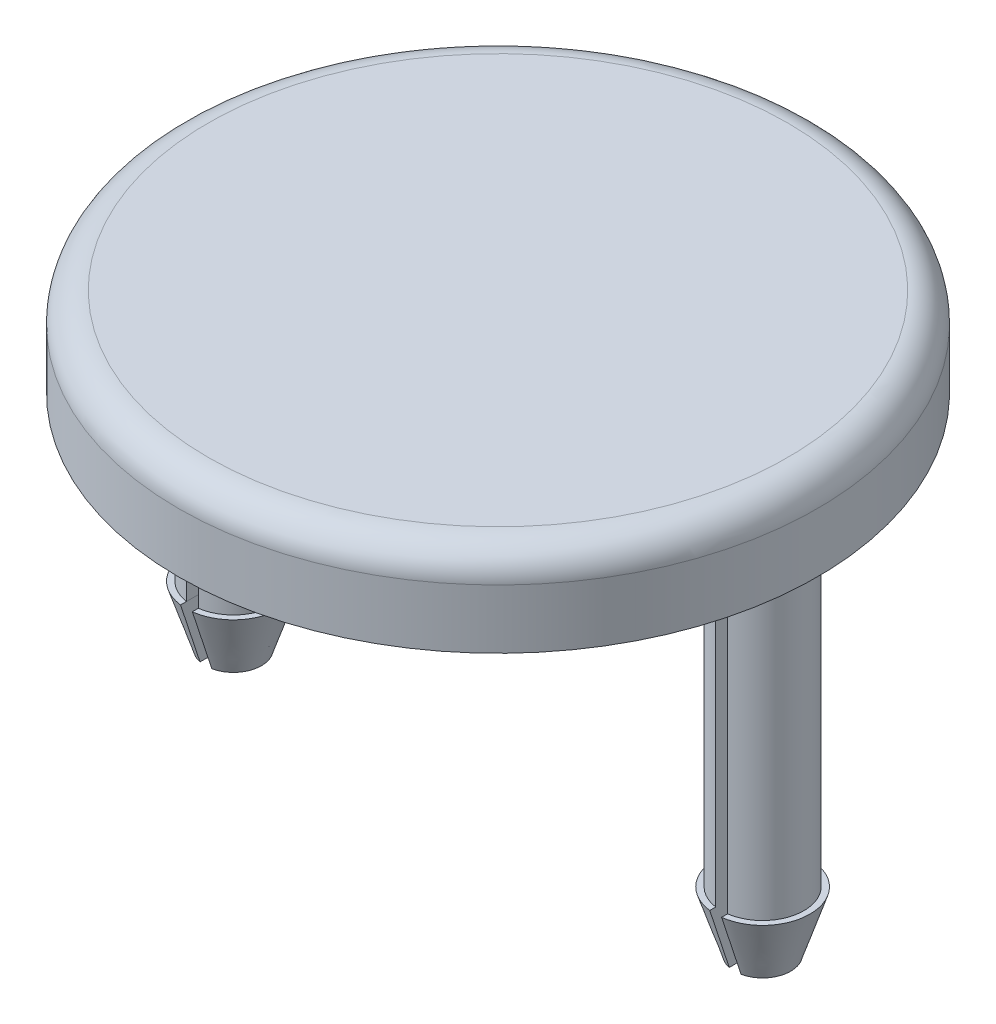
from build123d import *

# Parameters (mm, degrees)
SKETCH1_R           = 10.8
BOSS_EXTRUDE1_DEPTH = 3
BOSS_EXTRUDE3_DEPTH = 10
MIRROR3_START       = -10
MIRROR3_DEPTH       = 10
FILLET1_R           = 1
SKETCH6_R           = 2.4
BOSS_EXTRUDE4_DEPTH = 2
FILLET2_R           = 0.3


with BuildPart() as part:
    # Sketch1 → Boss-Extrude1 (new body)
    with BuildSketch(Plane(origin=(0, 0, 0), x_dir=(1, 0, 0), z_dir=(0, 1, 0))):
        with Locations(Location((0, 0, 0), (0, 0, 270))):
            Circle(SKETCH1_R)
    extrude(amount=BOSS_EXTRUDE1_DEPTH)

    # Sketch2 → Boss-Extrude3 (add)
    with BuildSketch(Plane.XZ):
        with BuildLine():
            Line((-9.15, 0), (-9.15, 1.385640646))
            ThreePointArc((-9.15, 1.385640646), (-10.35, 0), (-9.15, -1.385640646))
            Line((-9.15, -1.385640646), (-9.15, 0))
        make_face()
    boss_extrude3 = extrude(amount=BOSS_EXTRUDE3_DEPTH)


with BuildPart() as body_2:
    # Loft3: read off the stored shape, not the designer's step
    # Loft3: loft between two sections, ruled curve by curve
    loft3_from = [
        Edge.make_bspline([(-9.15, -10, 1.587450787), (-11.67, -10, 1.269960629), (-11.67, -10, -1.269960629), (-9.15, -10, -1.587450787)], [0, 0, 0, 0, 1, 1, 1, 1], 3, [1, 0.416666667, 0.416666667, 1]),
        Edge.make_line((-9.15, -10, 1.587450787), (-9.15, -10, -1.587450787)),
    ]
    loft3_to = [
        Edge.make_bspline([(-9.15, -12, 0.928708781), (-10.427777778, -12, 0.653535809), (-10.427777778, -12, -0.653535809), (-9.15, -12, -0.928708781)], [0, 0, 0, 0, 1, 1, 1, 1], 3, [1, 0.473684211, 0.473684211, 1]),
        Edge.make_line((-9.15, -12, 0.928708781), (-9.15, -12, -0.928708781)),
    ]
    loft3 = Solid(Shell([*[Face.make_surface_from_curves(loft3_from[k], loft3_to[k]) for k in range(2)], Face(Wire(loft3_from)), Face(Wire(loft3_to))]))
    add(loft3)


with BuildPart() as part_1:
    add(part.part)

    # Mirror2: Boss-Extrude3, Loft3 across plane
    add(boss_extrude3.mirror(Plane(origin=(-8.95, 0, 0), x_dir=(0, 0, 1), z_dir=(1, 0, 0))))
    add(loft3.mirror(Plane(origin=(-8.95, 0, 0), x_dir=(0, 0, 1), z_dir=(1, 0, 0))))

    # Mirror3: read off the stored shape, not the designer's step
    # Mirror3 outline → Mirror3 (add)
    with BuildSketch(Plane(origin=(0, 0, 0), x_dir=(1, 0, 0), z_dir=(0, 1, 0)).offset(MIRROR3_START)):
        with BuildLine():
            Line((9.15, 1.385640646), (9.15, -1.385640646))
            ThreePointArc((9.15, -1.385640646), (10.35, 0), (9.15, 1.385640646))
        make_face()
        with BuildLine():
            Line((8.75, -1.385640646), (8.75, 1.385640646))
            ThreePointArc((8.75, 1.385640646), (7.55, 0), (8.75, -1.385640646))
        make_face()
    extrude(amount=MIRROR3_DEPTH)

    # Mirror3 2: loft between two sections, ruled curve by curve
    mirror3_2_from = [
        Edge.make_bspline([(8.75, -10, 1.587450787), (6.23, -10, 1.269960629), (6.23, -10, -1.269960629), (8.75, -10, -1.587450787)], [0, 0, 0, 0, 1, 1, 1, 1], 3, [1, 0.416666667, 0.416666667, 1]),
        Edge.make_line((8.75, -10, -1.587450787), (8.75, -10, 1.587450787)),
    ]
    mirror3_2_to = [
        Edge.make_bspline([(8.75, -12, 0.928708781), (7.472222222, -12, 0.653535809), (7.472222222, -12, -0.653535809), (8.75, -12, -0.928708781)], [0, 0, 0, 0, 1, 1, 1, 1], 3, [1, 0.473684211, 0.473684211, 1]),
        Edge.make_line((8.75, -12, -0.928708781), (8.75, -12, 0.928708781)),
    ]
    mirror3_2 = Solid(Shell([*[Face.make_surface_from_curves(mirror3_2_from[k], mirror3_2_to[k]) for k in range(2)], Face(Wire(mirror3_2_from)), Face(Wire(mirror3_2_to))]))
    add(mirror3_2)

    # Mirror3 3: loft between two sections, ruled curve by curve
    mirror3_3_from = [
        Edge.make_bspline([(9.15, -10, 1.587450787), (11.67, -10, 1.269960629), (11.67, -10, -1.269960629), (9.15, -10, -1.587450787)], [0, 0, 0, 0, 1, 1, 1, 1], 3, [1, 0.416666667, 0.416666667, 1]),
        Edge.make_line((9.15, -10, -1.587450787), (9.15, -10, 1.587450787)),
    ]
    mirror3_3_to = [
        Edge.make_bspline([(9.15, -12, 0.928708781), (10.427777778, -12, 0.653535809), (10.427777778, -12, -0.653535809), (9.15, -12, -0.928708781)], [0, 0, 0, 0, 1, 1, 1, 1], 3, [1, 0.473684211, 0.473684211, 1]),
        Edge.make_line((9.15, -12, -0.928708781), (9.15, -12, 0.928708781)),
    ]
    mirror3_3 = Solid(Shell([*[Face.make_surface_from_curves(mirror3_3_from[k], mirror3_3_to[k]) for k in range(2)], Face(Wire(mirror3_3_from)), Face(Wire(mirror3_3_to))]))
    add(mirror3_3)

    # Fillet1
    fillet1_edges = [part_1.edges().sort_by_distance(p)[0] for p in [
        (0, 3, -10.8),
    ]]
    fillet(fillet1_edges, radius=FILLET1_R)

    # Sketch6 → Boss-Extrude4 (add)
    with BuildSketch(Plane.XZ):
        with Locations(Location((0, 0, 0), (0, 0, 90))):
            Circle(SKETCH6_R)
        Polygon((2.075, 0.6), (2.075, -0.6), (0.6, -0.6), (0.6, -2.075), (-0.6, -2.075), (-0.6, -0.6), (-2.075, -0.6), (-2.075, 0.6), (-0.6, 0.6), (-0.6, 2.075), (0.6, 2.075), (0.6, 0.6), align=None, mode=Mode.SUBTRACT)
    extrude(amount=BOSS_EXTRUDE4_DEPTH)

    # Fillet2
    fillet2_edges = [part_1.edges().sort_by_distance(p)[0] for p in [
        (0.6, -1, -0.6),
        (-0.6, -1, -0.6),
        (-0.6, -1, 0.6),
        (0.6, -1, 0.6),
    ]]
    fillet(fillet2_edges, radius=FILLET2_R)


solid = Compound([body_2.part, part_1.part])
